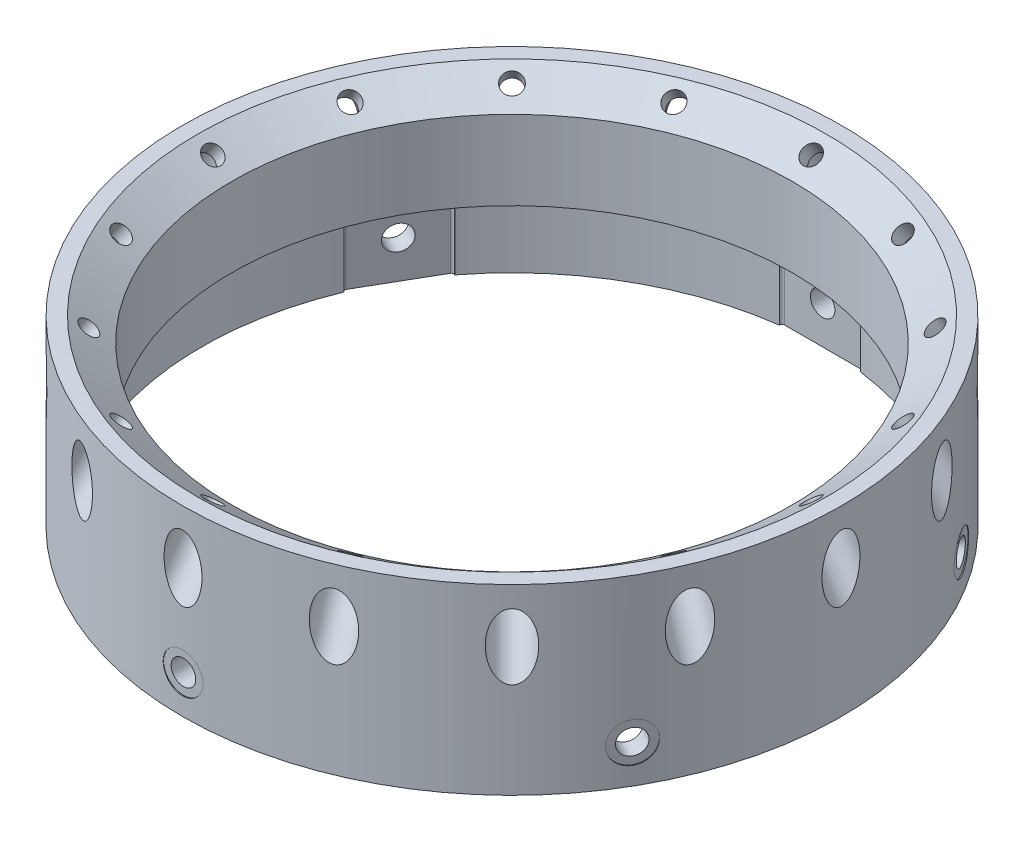
from build123d import *

# Parameters (mm, degrees)
HOLE_START                      = -3
SKETCH14_R                      = 5
HOLE_EXTRUDE_1_DEPTH            = 150.91522103
SCREW_EXTRUDE_D                 = 5
SCREW_HOLES_PATTERN_COUNT       = 16
WYTNIJ_WYCI_GNI_CIE3_REACH      = 128.007
WYTNIJ_WYCI_GNI_CIE3_END_RADIUS = 87
SZKIC14_R                       = 3.25
SZYK_KO_OWY2_COUNT              = 6
SKETCH16_R                      = 5.25
SKETCH16_R_2                    = 3.25
CUT_EXTRUDE1_DEPTH              = 0.25
CIRPATTERN1_COUNT               = 6
CUT_EXTRUDE2_DEPTH              = 21
CIRPATTERN2_COUNT               = 6
SKETCH18_W                      = 0.62
SKETCH18_H                      = 21
CUT_EXTRUDE3_DEPTH              = 10
FILLET1_R                       = 0.62
CIRPATTERN3_COUNT               = 6
FILLET1_OF_CIRPATTERN3_R        = 0.62


with BuildPart() as part:
    # Main sketch → Main revolve (revolve)
    with BuildSketch(Plane.XY, mode=Mode.PRIVATE) as main_revolve_sk:
        Polygon((-87, 0), (-87, 27.199169847), (-83, 27.199169847), (-74, 20.897302003), (-74, 0), (-81, 0), (-82, 0), (-82, -21), (-87, -21), align=None)
    revolve(main_revolve_sk.sketch.rotate(Axis((0, 0, 0), (0, -1, 0)), 270), axis=Axis((0, 0, 0), (0, -1, 0)))

    # Sketch14 → Hole extrude 1 (cut)
    with BuildSketch(Plane(origin=(-18.526734454, -26.458918881, 0), x_dir=(0.8191520442889891, -0.5735764363510499, 0), z_dir=(-0.5735764363510499, -0.8191520442889891, 0)).offset(HOLE_START)):
        with Locations(Location((-78.707324234, 0, 0), (0, 0, 180))):
            Circle(SKETCH14_R)
    hole_extrude_1 = extrude(amount=HOLE_EXTRUDE_1_DEPTH, mode=Mode.SUBTRACT)

    # screw extrude (through all)
    with Locations(Plane(origin=(-81.279270691, 21.1432038, 0), x_dir=(-0.819152044289, 0.573576436351, 0), z_dir=(-0.573576436351, -0.819152044289, 0))):
        with Locations((0, 0)):
            screw_extrude = Hole(SCREW_EXTRUDE_D / 2)

    # Screw holes pattern: Hole extrude 1, screw extrude ×16 about axis
    screw_holes_pattern_axis = Axis((0, 0, 0), (0, 1, 0))
    add([hole_extrude_1.rotate(screw_holes_pattern_axis, i * 360 / SCREW_HOLES_PATTERN_COUNT) for i in range(1, SCREW_HOLES_PATTERN_COUNT)], mode=Mode.SUBTRACT)
    add([screw_extrude.rotate(screw_holes_pattern_axis, i * 360 / SCREW_HOLES_PATTERN_COUNT) for i in range(1, SCREW_HOLES_PATTERN_COUNT)], mode=Mode.SUBTRACT)

    # Wytnij-wyciągnięcie3: up to this cylinder (the profile starts inside it)
    wytnij_wyci_gni_cie3_end = Plane(origin=(0, -11, 0), z_dir=(0, 1, 0)) * Cylinder(WYTNIJ_WYCI_GNI_CIE3_END_RADIUS, 431.014, mode=Mode.PRIVATE)
    # Szkic14 → Wytnij-wyciągnięcie3 (cut, up to the surface)
    with BuildSketch(Plane.XY, mode=Mode.PRIVATE) as wytnij_wyci_gni_cie3_sk1:
        with Locations((0, -11)):
            Circle(SZKIC14_R)
    wytnij_wyci_gni_cie3_tool1 = extrude(wytnij_wyci_gni_cie3_sk1.sketch, amount=-WYTNIJ_WYCI_GNI_CIE3_REACH, mode=Mode.PRIVATE) & wytnij_wyci_gni_cie3_end
    wytnij_wyci_gni_cie3 = wytnij_wyci_gni_cie3_tool1.solids().sort_by_distance((0, -11, 0))[0]
    add(wytnij_wyci_gni_cie3, mode=Mode.SUBTRACT)

    # Szyk kołowy2: Wytnij-wyciągnięcie3 ×6 about axis
    szyk_ko_owy2_axis = Axis((0, -21, 0), (0, 1, 0))
    for i in range(1, SZYK_KO_OWY2_COUNT):
        add(wytnij_wyci_gni_cie3.rotate(szyk_ko_owy2_axis, i * 360 / SZYK_KO_OWY2_COUNT), mode=Mode.SUBTRACT)

    # Sketch16 → Cut-Extrude1 (cut)
    with BuildSketch(Plane.XY.offset(87)):
        with Locations((0, -11)):
            Circle(SKETCH16_R)
        with Locations(Location((0, -11, 0), (0, 0, 180))):
            Circle(SKETCH16_R_2, mode=Mode.SUBTRACT)
    cut_extrude1 = extrude(amount=-CUT_EXTRUDE1_DEPTH, mode=Mode.SUBTRACT)

    # CirPattern1: Cut-Extrude1 ×6 about axis
    cirpattern1_axis = Axis((0, 0, 0), (0, 1, 0))
    for i in range(1, CIRPATTERN1_COUNT):
        add(cut_extrude1.rotate(cirpattern1_axis, i * 360 / CIRPATTERN1_COUNT), mode=Mode.SUBTRACT)

    # Sketch17 → Cut-Extrude2 (cut)
    with BuildSketch(Plane.XZ.offset(21)):
        Polygon((10.1, -80.819018068), (10.1, -82.01635825), (0, -82.01635825), (-10.1, -82.01635825), (-10.1, -80.819018068), (0, -80.819018068), align=None)
    cut_extrude2 = extrude(amount=-CUT_EXTRUDE2_DEPTH, mode=Mode.SUBTRACT)

    # CirPattern2: Cut-Extrude2 ×6 about axis
    cirpattern2_axis = Axis((0, 0, 0), (0, 1, 0))
    for i in range(1, CIRPATTERN2_COUNT):
        add(cut_extrude2.rotate(cirpattern2_axis, i * 360 / CIRPATTERN2_COUNT), mode=Mode.SUBTRACT)

    # Sketch18 → Cut-Extrude3 (cut)
    with BuildSketch(Plane.XY.offset(-82.01635825)):
        with Locations((-10.41, -10.5)):
            Rectangle(SKETCH18_W, SKETCH18_H)
        with Locations((10.41, -10.5)):
            Rectangle(SKETCH18_W, SKETCH18_H)
    cut_extrude3 = extrude(amount=CUT_EXTRUDE3_DEPTH, mode=Mode.SUBTRACT)

    # Fillet1
    fillet1_edges = [part.edges().sort_by_distance(p)[0] for p in [
        (-10.72, -10.5, -82.01635825),
        (10.72, -10.5, -82.01635825),
    ]]
    fillet(fillet1_edges, radius=FILLET1_R)

    # CirPattern3: Cut-Extrude3 ×6 about axis
    cirpattern3_axis = Axis((0, 0, 0), (0, 1, 0))
    for i in range(1, CIRPATTERN3_COUNT):
        add(cut_extrude3.rotate(cirpattern3_axis, i * 360 / CIRPATTERN3_COUNT), mode=Mode.SUBTRACT)

    # Fillet1 of CirPattern3
    fillet1_of_cirpattern3_edges = [part.edges().sort_by_distance(p)[0] for p in [
        (-76.38824977, -10.5, -31.724386796),
        (-65.66824977, -10.5, -50.291971453),
        (-65.66824977, -10.5, 50.291971453),
        (-76.38824977, -10.5, 31.724386796),
        (10.72, -10.5, 82.01635825),
        (-10.72, -10.5, 82.01635825),
        (76.38824977, -10.5, 31.724386796),
        (65.66824977, -10.5, 50.291971453),
        (65.66824977, -10.5, -50.291971453),
        (76.38824977, -10.5, -31.724386796),
    ]]
    fillet(fillet1_of_cirpattern3_edges, radius=FILLET1_OF_CIRPATTERN3_R)


solid = part.part
